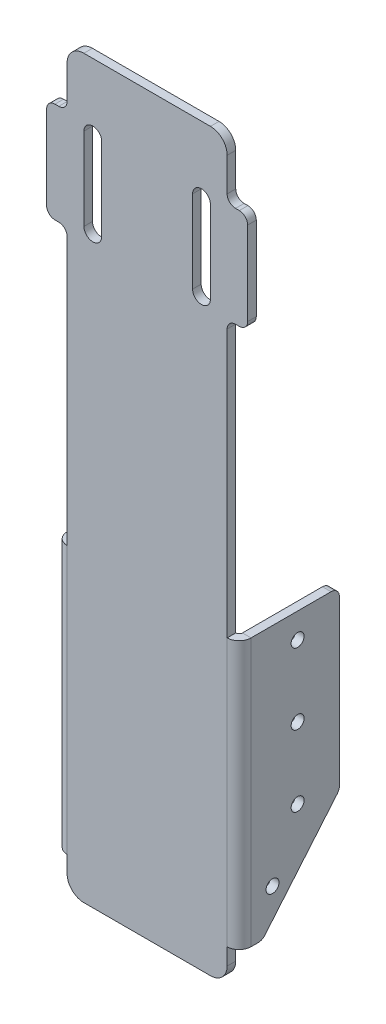
from build123d import *
from OCP.BRepFilletAPI import BRepFilletAPI_MakeChamfer

# Parameters (mm, degrees)
SKETCH2_W                    = 60.7822
SKETCH2_H                    = 279.4
BASE_FLANGE1_DEPTH           = 3.2639
EDGE_FLANGE1_DEPTH           = 101.6
EDGE_FLANGE1_BEND_DEPTH      = 101.6
CHAMFER1_SIZE                = 34.925
CHAMFER1_SIZE2               = 29.305554619
F_10_0_1935_DIAMETER_HOLE1_D = 4.9149
F_1_4_START                  = -3.2639
F_1_4_CLEARANCE_SLOT1_DEPTH  = 3.2639
SKETCH17_W                   = 7.7978
SKETCH17_H                   = 38.1
BOSS_EXTRUDE1_DEPTH          = 3.2639
FILLET1_R                    = 3.175
FILLET2_R                    = 6.35


# Read off the part's stored shape, not the designer's step: 1/4 Clearance Slot1
# Sheet-metal steps are written as plain solids
with BuildPart() as part:
    # Sketch2 → Base-Flange1 (new body)
    with BuildSketch(Plane.XY):
        with Locations((0, 139.7)):
            Rectangle(SKETCH2_W, SKETCH2_H)
    extrude(amount=-BASE_FLANGE1_DEPTH)

    # Edge-Flange1 section (across the edge) → Edge-Flange1 (add)
    with BuildSketch(Plane(origin=(31.6611, 114.3, -3.2639), x_dir=(-1, 0, 0), z_dir=(0, -1, 0))):
        with BuildLine():
            Line((-3.2639, 1.27), (-3.2639, 34.8361))
            Line((-3.2639, 34.8361), (0, 34.8361))
            Line((0, 34.8361), (0, 1.27))
            ThreePointArc((0, 1.27), (0.371974388, 0.371974388), (1.27, 0))
            Line((1.27, 0), (1.27, -3.2639))
            ThreePointArc((1.27, -3.2639), (-1.935951435, -1.935951435), (-3.2639, 1.27))
        make_face()
    extrude(amount=EDGE_FLANGE1_DEPTH)

    # Edge-Flange1 section 2 (across the edge) → Edge-Flange1 bend (add)
    with BuildSketch(Plane(origin=(-31.6611, 12.7, -3.2639), x_dir=(1, 0, 0), z_dir=(0, 1, 0))):
        with BuildLine():
            Line((-3.2639, 1.27), (-3.2639, 34.8361))
            Line((-3.2639, 34.8361), (0, 34.8361))
            Line((0, 34.8361), (0, 1.27))
            ThreePointArc((0, 1.27), (0.371974388, 0.371974388), (1.27, 0))
            Line((1.27, 0), (1.27, -3.2639))
            ThreePointArc((1.27, -3.2639), (-1.935951435, -1.935951435), (-3.2639, 1.27))
        make_face()
    extrude(amount=EDGE_FLANGE1_BEND_DEPTH)

    # Chamfer1: one chamfer whose edges measure the first distance from different faces: ONE call of the kernel's chamfer builder (chamfer() names one face for all edges)
    chamfer1_edges_1 = [part.edges().sort_by_distance(p)[0] for p in [
        (33.29305, 12.7, -38.1),
    ]]
    chamfer1_side_1 = [part.faces().sort_by_distance(p)[0] for p in [
        (33.29305, 63.5, -38.1),
    ]]
    chamfer1_edges_2 = [part.edges().sort_by_distance(p)[0] for p in [
        (-33.29305, 12.7, -38.1),
    ]]
    chamfer1_side_2 = [part.faces().sort_by_distance(p)[0] for p in [
        (-33.29305, 63.5, -38.1),
    ]]
    chamfer1 = BRepFilletAPI_MakeChamfer(part.part.solid().wrapped)
    for e in chamfer1_edges_1:
        chamfer1.Add(CHAMFER1_SIZE, CHAMFER1_SIZE2, e.wrapped, chamfer1_side_1[0].wrapped)  # the first distance lies on this face
    for e in chamfer1_edges_2:
        chamfer1.Add(CHAMFER1_SIZE, CHAMFER1_SIZE2, e.wrapped, chamfer1_side_2[0].wrapped)  # the first distance lies on this face
    add(Compound.cast(chamfer1.Shape()), mode=Mode.REPLACE)

    # #10 (0.1935) Diameter Hole1 (through all)
    with Locations(Plane(origin=(34.925, 0, 0), x_dir=(0, 0, -1), z_dir=(1, 0, 0))):
        with Locations((22.225, 104.775), (22.225, 77.7875), (22.225, 50.8), (12.7, 28.575)):
            Hole(F_10_0_1935_DIAMETER_HOLE1_D / 2)

    # 1/4 Clearance Slot1 outline → 1/4 Clearance Slot1 (cut)
    with BuildSketch(Plane.XY.offset(F_1_4_START)):
        with BuildLine():
            ThreePointArc((-17.2593, 253.7968), (-20.6375, 257.175), (-24.0157, 253.7968))
            Line((-24.0157, 253.7968), (-24.0157, 222.4532))
            ThreePointArc((-24.0157, 222.4532), (-20.6375, 219.075), (-17.2593, 222.4532))
            Line((-17.2593, 222.4532), (-17.2593, 253.7968))
        make_face()
        with BuildLine():
            ThreePointArc((24.0157, 253.7968), (20.6375, 257.175), (17.2593, 253.7968))
            Line((17.2593, 253.7968), (17.2593, 222.4532))
            ThreePointArc((17.2593, 222.4532), (20.6375, 219.075), (24.0157, 222.4532))
            Line((24.0157, 222.4532), (24.0157, 253.7968))
        make_face()
    extrude(amount=F_1_4_CLEARANCE_SLOT1_DEPTH, mode=Mode.SUBTRACT)

    # Sketch17 → Boss-Extrude1 (add)
    with BuildSketch(Plane(origin=(0, 0, -3.2639), x_dir=(-1, 0, 0), z_dir=(0, 0, -1))):
        with Locations((-34.29, 238.125)):
            Rectangle(SKETCH17_W, SKETCH17_H)
        with Locations((34.29, 238.125)):
            Rectangle(SKETCH17_W, SKETCH17_H)
    extrude(amount=-BOSS_EXTRUDE1_DEPTH)

    # Fillet1
    fillet1_edges = [part.edges().sort_by_distance(p)[0] for p in [
        (30.3911, 219.075, -1.63195),
        (30.3911, 257.175, -1.63195),
        (38.1889, 257.175, -1.63195),
        (38.1889, 219.075, -1.63195),
        (-38.1889, 257.175, -1.63195),
        (-38.1889, 219.075, -1.63195),
        (-30.3911, 219.075, -1.63195),
        (-30.3911, 257.175, -1.63195),
        (33.29305, 114.3, -38.1),
        (-33.29305, 114.3, -38.1),
        (33.29305, 47.625, -38.1),
        (33.29305, 12.7, -8.794445381),
        (-33.29305, 12.7, -8.794445381),
        (-33.29305, 47.625, -38.1),
    ]]
    fillet(fillet1_edges, radius=FILLET1_R)

    # Fillet2
    fillet2_edges = [part.edges().sort_by_distance(p)[0] for p in [
        (-30.3911, 279.4, -1.63195),
        (30.3911, 279.4, -1.63195),
        (30.3911, 0, -1.63195),
        (-30.3911, 0, -1.63195),
    ]]
    fillet(fillet2_edges, radius=FILLET2_R)


solid = part.part
